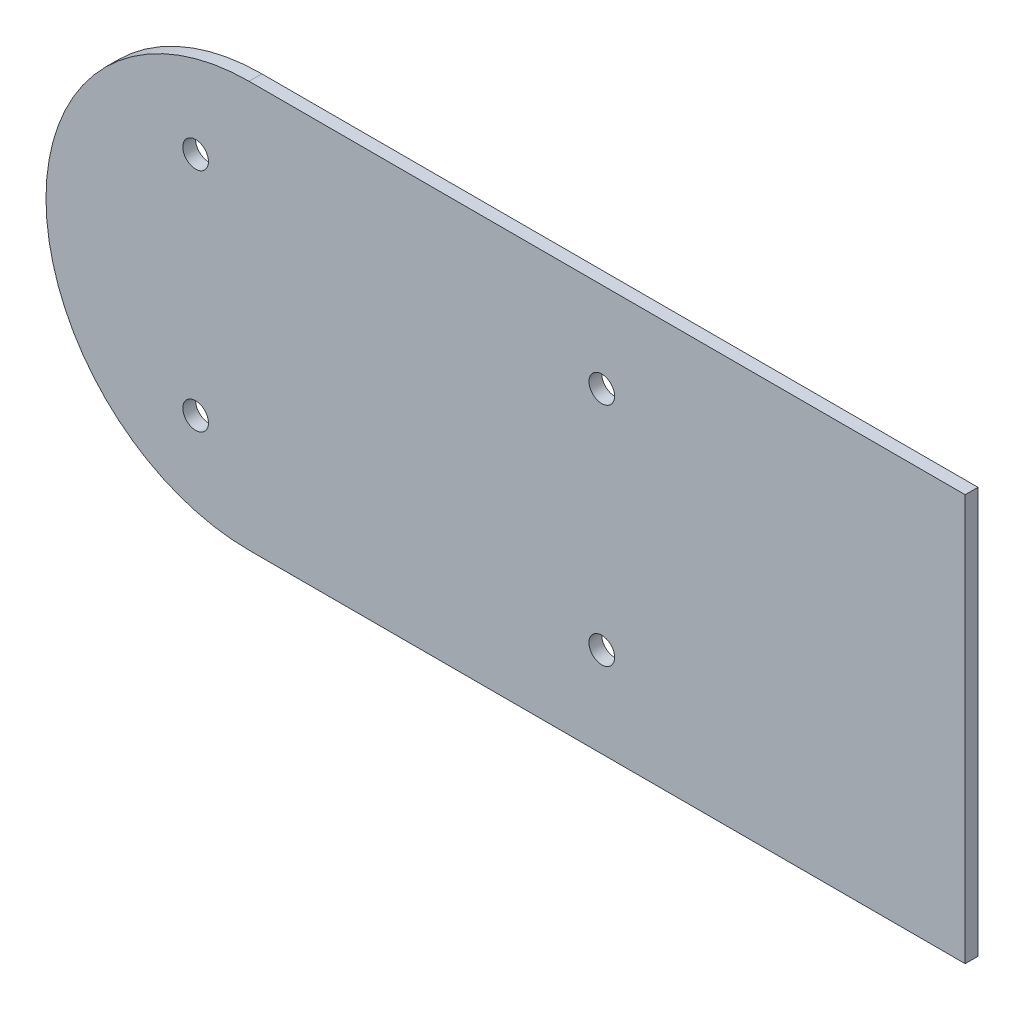
from build123d import *

# Parameters (mm, degrees)
SKETCH1_W           = 430
SKETCH1_H           = 190
SKETCH1_R           = 6
BOSS_EXTRUDE1_DEPTH = 6
FILLET1_R           = 95


with BuildPart() as part:
    # Sketch1 → Boss-Extrude1 (new body)
    with BuildSketch(Plane.XY):
        Rectangle(SKETCH1_W, SKETCH1_H)
        with Locations((-145, 52.92)):
            Circle(SKETCH1_R, mode=Mode.SUBTRACT)
        with Locations((45, 52.92)):
            Circle(SKETCH1_R, mode=Mode.SUBTRACT)
        with Locations((45, -52.92)):
            Circle(SKETCH1_R, mode=Mode.SUBTRACT)
        with Locations((-145, -52.92)):
            Circle(SKETCH1_R, mode=Mode.SUBTRACT)
    extrude(amount=BOSS_EXTRUDE1_DEPTH)

    # Fillet1
    fillet1_edges = [part.edges().sort_by_distance(p)[0] for p in [
        (-215, -95, 3),
        (-215, 95, 3),
    ]]
    fillet(fillet1_edges, radius=FILLET1_R - 0.0001)  # a hair under: the kernel refuses the full size


solid = part.part
